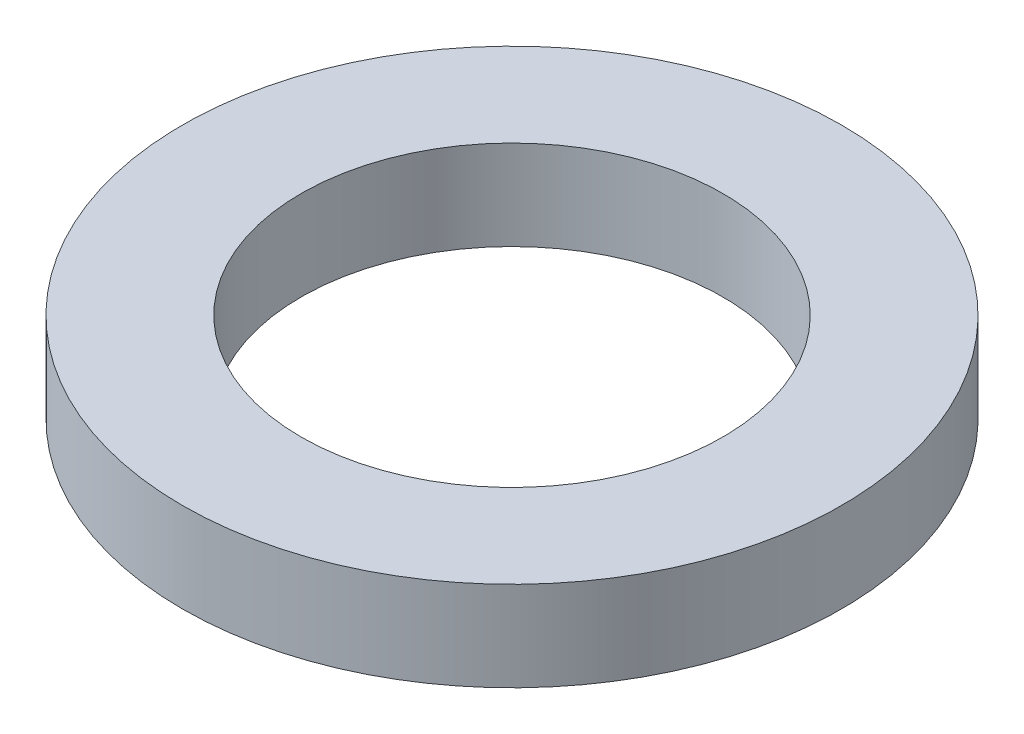
from build123d import *

# Parameters (mm, degrees)
SKETCH1_R           = 62.5
BOSS_EXTRUDE1_DEPTH = 17
SKETCH2_R           = 40
CUT_EXTRUDE1_DEPTH  = 91.008332948


with BuildPart() as part:
    # Sketch1 → Boss-Extrude1 (new body)
    with BuildSketch(Plane(origin=(0, 0, 0), x_dir=(1, 0, 0), z_dir=(0, 1, 0))):
        Circle(SKETCH1_R)
    extrude(amount=BOSS_EXTRUDE1_DEPTH)

    # Sketch2 → Cut-Extrude1 (cut, through all)
    with BuildSketch(Plane(origin=(0, 0, 0), x_dir=(1, 0, 0), z_dir=(0, 1, 0))):
        Circle(SKETCH2_R)
    extrude(amount=CUT_EXTRUDE1_DEPTH, mode=Mode.SUBTRACT)


solid = part.part
